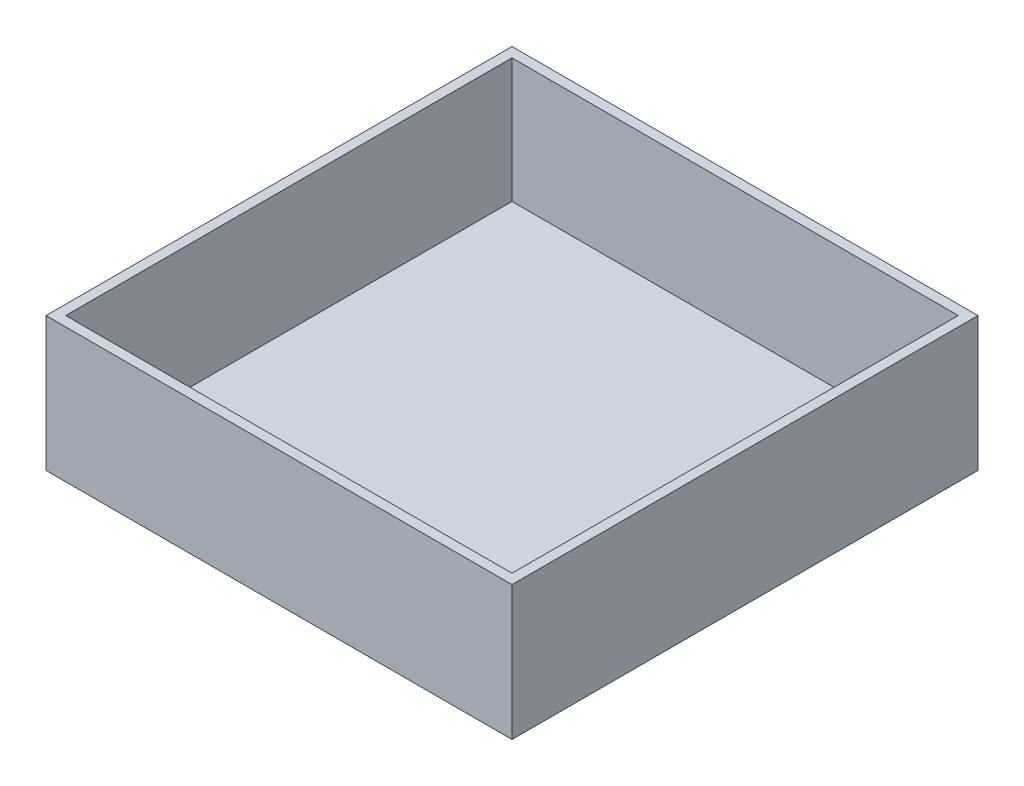
from build123d import *

# Parameters (mm, degrees)
SKETCH1_W           = 300
SKETCH1_H           = 300
SKETCH1_W_2         = 287.3
SKETCH1_H_2         = 287.3
BOSS_EXTRUDE1_DEPTH = 80
SKETCH2_W           = 300
SKETCH2_H           = 300
BOSS_EXTRUDE2_DEPTH = 6.35


with BuildPart() as part:
    # Sketch1 → Boss-Extrude1 (new body)
    with BuildSketch(Plane(origin=(0, 0, 0), x_dir=(1, 0, 0), z_dir=(0, 1, 0))):
        Rectangle(SKETCH1_W, SKETCH1_H)
        Rectangle(SKETCH1_W_2, SKETCH1_H_2, mode=Mode.SUBTRACT)
    extrude(amount=BOSS_EXTRUDE1_DEPTH)

    # Sketch2 → Boss-Extrude2 (add)
    with BuildSketch(Plane.XZ):
        Rectangle(SKETCH2_W, SKETCH2_H)
    extrude(amount=BOSS_EXTRUDE2_DEPTH)


solid = part.part
